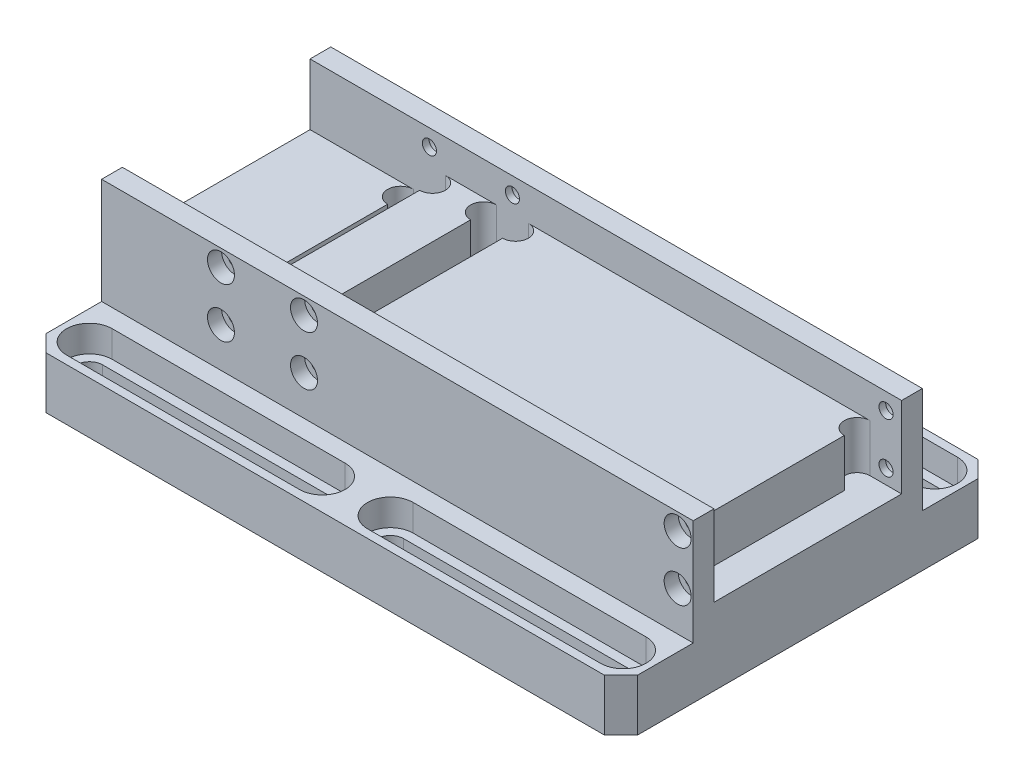
from build123d import *

# Parameters (mm, degrees)
SKETCH1_W                                      = 142.5
SKETCH1_H                                      = 90
BOSS_EXTRUDE1_DEPTH                            = 12.5
CHAMFER1_SIZE                                  = 4
SKETCH3_W                                      = 142.5
SKETCH3_H                                      = 55.2
BOSS_EXTRUDE2_DEPTH                            = 25.5
SKETCH7_W                                      = 142.5
SKETCH7_H                                      = 45.2
CUT_EXTRUDE4_DEPTH                             = 8
SKETCH8_W                                      = 7.7
SKETCH8_H                                      = 32.8
SKETCH8_H_2                                    = 6.2
SKETCH8_H_3                                    = 45.2
CUT_EXTRUDE5_DEPTH                             = 11.5
SKETCH9_W                                      = 24.9
SKETCH9_H                                      = 45.2
CUT_EXTRUDE6_DEPTH                             = 6.75
CBORE_START                                    = 24.2
CBORE_FOR_M3_HEX_SOCKET_HEAD_CAP_SCR_2_R       = 3.25
CBORE_FOR_M3_HEX_SOCKET_HEAD_CAP_SCREW1_DEPTH  = 3.4
CBORE_START_2                                  = 22.6
CBORE_FOR_M3_HEX_SOCKET_HEAD_CAP_SCR_3_O_R     = 1.7
CBORE_FOR_M3_HEX_SOCKET_HEAD_CAP_SCR_3_DEPTH   = 1.6
CBORE_SLOT_FOR_M6_HEX_SOCKET_HEAD_CAP_SC_DEPTH = 12.5
CBORE_START_3                                  = 6.1
CBORE_SLOT_FOR_M6_HEX_SOCKET_HEAD_CA_3_DEPTH   = 6.4


# Read off the part's stored shape, not the designer's step: CBORE for M3 Hex Socket Head Cap Screw1, CBORE SLOT for M6 Hex Socket Head Cap Screw1
with BuildPart() as part:
    # Sketch1 → Boss-Extrude1 (new body)
    with BuildSketch(Plane(origin=(0, 0, 0), x_dir=(1, 0, 0), z_dir=(0, 1, 0))):
        Rectangle(SKETCH1_W, SKETCH1_H)
    extrude(amount=BOSS_EXTRUDE1_DEPTH)

    # Chamfer1
    chamfer1_edges = [part.edges().sort_by_distance(p)[0] for p in [
        (-71.25, 6.25, 45),
        (-71.25, 6.25, -45),
        (71.25, 6.25, -45),
        (71.25, 6.25, 45),
    ]]
    chamfer(chamfer1_edges, length=CHAMFER1_SIZE)

    # Sketch3 → Boss-Extrude2 (add)
    with BuildSketch(Plane(origin=(0, 12.5, 0), x_dir=(1, 0, 0), z_dir=(0, 1, 0))):
        Rectangle(SKETCH3_W, SKETCH3_H)
    extrude(amount=BOSS_EXTRUDE2_DEPTH)

    # Sketch7 → Cut-Extrude4 (cut)
    with BuildSketch(Plane(origin=(0, 38, 0), x_dir=(1, 0, 0), z_dir=(0, 1, 0))):
        Rectangle(SKETCH7_W, SKETCH7_H)
    extrude(amount=-CUT_EXTRUDE4_DEPTH, mode=Mode.SUBTRACT)

    # Sketch8 → Cut-Extrude5 (cut)
    with BuildSketch(Plane(origin=(0, 30, 0), x_dir=(1, 0, 0), z_dir=(0, 1, 0))):
        with BuildLine():
            ThreePointArc((-46.35, 22.6), (-49.45, 19.5), (-46.35, 16.4))
            Line((-46.35, 16.4), (-46.35, 22.6))
        make_face()
        with BuildLine():
            Line((-38.65, 22.6), (-38.65, 16.4))
            ThreePointArc((-38.65, 16.4), (-35.55, 19.5), (-38.65, 22.6))
        make_face()
        with Locations((-42.5, 0)):
            Rectangle(SKETCH8_W, SKETCH8_H)
        with Locations((-42.5, 19.5)):
            Rectangle(SKETCH8_W, SKETCH8_H_2)
        with BuildLine():
            ThreePointArc((-46.35, -16.4), (-49.45, -19.5), (-46.35, -22.6))
            Line((-46.35, -22.6), (-46.35, -16.4))
        make_face()
        with BuildLine():
            Line((-38.65, -16.4), (-38.65, -22.6))
            ThreePointArc((-38.65, -22.6), (-35.55, -19.5), (-38.65, -16.4))
        make_face()
        with Locations((-42.5, -19.5)):
            Rectangle(SKETCH8_W, SKETCH8_H_2)
        with Locations((-22.5, 0)):
            Rectangle(SKETCH8_W, SKETCH8_H_3)
        with BuildLine():
            Line((-26.35, 16.4), (-18.65, 16.4))
            ThreePointArc((-18.65, 16.4), (-15.55, 19.5), (-18.65, 22.6))
            Line((-18.65, 22.6), (-26.35, 22.6))
            ThreePointArc((-26.35, 22.6), (-29.45, 19.5), (-26.35, 16.4))
        make_face()
        with BuildLine():
            Line((-26.35, -22.6), (-18.65, -22.6))
            ThreePointArc((-18.65, -22.6), (-15.55, -19.5), (-18.65, -16.4))
            Line((-18.65, -16.4), (-26.35, -16.4))
            ThreePointArc((-26.35, -16.4), (-29.45, -19.5), (-26.35, -22.6))
        make_face()
        with Locations((67.5, 0)):
            Rectangle(SKETCH8_W, SKETCH8_H_3)
        with BuildLine():
            Line((63.65, 16.4), (71.35, 16.4))
            ThreePointArc((71.35, 16.4), (74.45, 19.5), (71.35, 22.6))
            Line((71.35, 22.6), (63.65, 22.6))
            ThreePointArc((63.65, 22.6), (60.55, 19.5), (63.65, 16.4))
        make_face()
        with BuildLine():
            Line((63.65, -22.6), (71.35, -22.6))
            ThreePointArc((71.35, -22.6), (74.45, -19.5), (71.35, -16.4))
            Line((71.35, -16.4), (63.65, -16.4))
            ThreePointArc((63.65, -16.4), (60.55, -19.5), (63.65, -22.6))
        make_face()
    extrude(amount=-CUT_EXTRUDE5_DEPTH, mode=Mode.SUBTRACT)

    # Sketch9 → Cut-Extrude6 (cut)
    with BuildSketch(Plane(origin=(0, 30, 0), x_dir=(1, 0, 0), z_dir=(0, 1, 0))):
        with Locations((-58.8, 0)):
            Rectangle(SKETCH9_W, SKETCH9_H)
    extrude(amount=-CUT_EXTRUDE6_DEPTH, mode=Mode.SUBTRACT)

    # CBORE for M3 Hex Socket Head Cap Scr 2 → CBORE for M3 Hex Socket Head Cap Screw1 (cut)
    with BuildSketch(Plane.XY.offset(CBORE_START)):
        with Locations((-42.5, 34)):
            Circle(CBORE_FOR_M3_HEX_SOCKET_HEAD_CAP_SCR_2_R)
        with Locations((-42.5, 22)):
            Circle(CBORE_FOR_M3_HEX_SOCKET_HEAD_CAP_SCR_2_R)
        with Locations((-22.5, 22)):
            Circle(CBORE_FOR_M3_HEX_SOCKET_HEAD_CAP_SCR_2_R)
        with Locations((-22.5, 34)):
            Circle(CBORE_FOR_M3_HEX_SOCKET_HEAD_CAP_SCR_2_R)
        with Locations((67.5, 22)):
            Circle(CBORE_FOR_M3_HEX_SOCKET_HEAD_CAP_SCR_2_R)
        with Locations((67.5, 34)):
            Circle(CBORE_FOR_M3_HEX_SOCKET_HEAD_CAP_SCR_2_R)
    cbore_for_m3_hex_socket_head_cap_screw1 = extrude(amount=CBORE_FOR_M3_HEX_SOCKET_HEAD_CAP_SCREW1_DEPTH, mode=Mode.SUBTRACT)

    # CBORE for M3 Hex Socket Head Cap Scr 3 o → CBORE for M3 Hex Socket Head Cap Scr 3 (cut)
    with BuildSketch(Plane.XY.offset(CBORE_START_2)):
        with Locations((-42.5, 34)):
            Circle(CBORE_FOR_M3_HEX_SOCKET_HEAD_CAP_SCR_3_O_R)
        with Locations((-42.5, 22)):
            Circle(CBORE_FOR_M3_HEX_SOCKET_HEAD_CAP_SCR_3_O_R)
        with Locations((-22.5, 22)):
            Circle(CBORE_FOR_M3_HEX_SOCKET_HEAD_CAP_SCR_3_O_R)
        with Locations((-22.5, 34)):
            Circle(CBORE_FOR_M3_HEX_SOCKET_HEAD_CAP_SCR_3_O_R)
        with Locations((67.5, 22)):
            Circle(CBORE_FOR_M3_HEX_SOCKET_HEAD_CAP_SCR_3_O_R)
        with Locations((67.5, 34)):
            Circle(CBORE_FOR_M3_HEX_SOCKET_HEAD_CAP_SCR_3_O_R)
    cbore_for_m3_hex_socket_head_cap_scr_3 = extrude(amount=CBORE_FOR_M3_HEX_SOCKET_HEAD_CAP_SCR_3_DEPTH, mode=Mode.SUBTRACT)

    # Mirror1: CBORE for M3 Hex Socket Head Cap Screw1, CBORE for M3 Hex Socket Head Cap Scr 3 across plane
    add(cbore_for_m3_hex_socket_head_cap_screw1.mirror(Plane.XY), mode=Mode.SUBTRACT)
    add(cbore_for_m3_hex_socket_head_cap_scr_3.mirror(Plane.XY), mode=Mode.SUBTRACT)

    # CBORE SLOT for M6 Hex Socket Head Ca 2 → CBORE SLOT for M6 Hex Socket Head Cap Screw1 (cut)
    with BuildSketch(Plane(origin=(0, 0, 0), x_dir=(1, 0, 0), z_dir=(0, 1, 0))):
        with BuildLine():
            Line((8.2, -40.7), (64.3, -40.7))
            ThreePointArc((64.3, -40.7), (67.5, -37.5), (64.3, -34.3))
            Line((64.3, -34.3), (8.2, -34.3))
            ThreePointArc((8.2, -34.3), (5, -37.5), (8.2, -40.7))
        make_face()
        with BuildLine():
            ThreePointArc((-8.2, -40.7), (-5, -37.5), (-8.2, -34.3))
            Line((-8.2, -34.3), (-64.3, -34.3))
            ThreePointArc((-64.3, -34.3), (-67.5, -37.5), (-64.3, -40.7))
            Line((-64.3, -40.7), (-8.2, -40.7))
        make_face()
        with BuildLine():
            Line((8.2, 34.3), (64.3, 34.3))
            ThreePointArc((64.3, 34.3), (67.5, 37.5), (64.3, 40.7))
            Line((64.3, 40.7), (8.2, 40.7))
            ThreePointArc((8.2, 40.7), (5, 37.5), (8.2, 34.3))
        make_face()
        with BuildLine():
            ThreePointArc((-8.2, 34.3), (-5, 37.5), (-8.2, 40.7))
            Line((-8.2, 40.7), (-64.3, 40.7))
            ThreePointArc((-64.3, 40.7), (-67.5, 37.5), (-64.3, 34.3))
            Line((-64.3, 34.3), (-8.2, 34.3))
        make_face()
    extrude(amount=CBORE_SLOT_FOR_M6_HEX_SOCKET_HEAD_CAP_SC_DEPTH, mode=Mode.SUBTRACT)

    # CBORE SLOT for M6 Hex Socket Head Ca 3 o → CBORE SLOT for M6 Hex Socket Head Ca 3 (cut)
    # profile 1 of 4: a face of its own
    with BuildSketch(Plane(origin=(0, 0, 0), x_dir=(1, 0, 0), z_dir=(0, 1, 0)).offset(CBORE_START_3)):
        with BuildLine():
            Line((8.2, -43), (64.3, -43))
            ThreePointArc((64.3, -43), (69.8, -37.5), (64.3, -32))
            Line((64.3, -32), (8.2, -32))
            ThreePointArc((8.2, -32), (2.7, -37.5), (8.2, -43))
        make_face()
        with BuildLine():
            ThreePointArc((64.3, -34.3), (67.5, -37.5), (64.3, -40.7))
            Line((64.3, -40.7), (8.2, -40.7))
            ThreePointArc((8.2, -40.7), (5, -37.5), (8.2, -34.3))
            Line((8.2, -34.3), (64.3, -34.3))
        make_face(mode=Mode.SUBTRACT)
    # profile 2 of 4: a face of its own
    with BuildSketch(Plane(origin=(0, 0, 0), x_dir=(1, 0, 0), z_dir=(0, 1, 0)).offset(CBORE_START_3)):
        with BuildLine():
            ThreePointArc((-8.2, -43), (-2.7, -37.5), (-8.2, -32))
            Line((-8.2, -32), (-64.3, -32))
            ThreePointArc((-64.3, -32), (-69.8, -37.5), (-64.3, -43))
            Line((-64.3, -43), (-8.2, -43))
        make_face()
        with BuildLine():
            Line((-64.3, -34.3), (-8.2, -34.3))
            ThreePointArc((-8.2, -34.3), (-5, -37.5), (-8.2, -40.7))
            Line((-8.2, -40.7), (-64.3, -40.7))
            ThreePointArc((-64.3, -40.7), (-67.5, -37.5), (-64.3, -34.3))
        make_face(mode=Mode.SUBTRACT)
    # profile 3 of 4: a face of its own
    with BuildSketch(Plane(origin=(0, 0, 0), x_dir=(1, 0, 0), z_dir=(0, 1, 0)).offset(CBORE_START_3)):
        with BuildLine():
            Line((8.2, 32), (64.3, 32))
            ThreePointArc((64.3, 32), (69.8, 37.5), (64.3, 43))
            Line((64.3, 43), (8.2, 43))
            ThreePointArc((8.2, 43), (2.7, 37.5), (8.2, 32))
        make_face()
        with BuildLine():
            ThreePointArc((64.3, 40.7), (67.5, 37.5), (64.3, 34.3))
            Line((64.3, 34.3), (8.2, 34.3))
            ThreePointArc((8.2, 34.3), (5, 37.5), (8.2, 40.7))
            Line((8.2, 40.7), (64.3, 40.7))
        make_face(mode=Mode.SUBTRACT)
    # profile 4 of 4: a face of its own
    with BuildSketch(Plane(origin=(0, 0, 0), x_dir=(1, 0, 0), z_dir=(0, 1, 0)).offset(CBORE_START_3)):
        with BuildLine():
            ThreePointArc((-8.2, 32), (-2.7, 37.5), (-8.2, 43))
            Line((-8.2, 43), (-64.3, 43))
            ThreePointArc((-64.3, 43), (-69.8, 37.5), (-64.3, 32))
            Line((-64.3, 32), (-8.2, 32))
        make_face()
        with BuildLine():
            Line((-64.3, 40.7), (-8.2, 40.7))
            ThreePointArc((-8.2, 40.7), (-5, 37.5), (-8.2, 34.3))
            Line((-8.2, 34.3), (-64.3, 34.3))
            ThreePointArc((-64.3, 34.3), (-67.5, 37.5), (-64.3, 40.7))
        make_face(mode=Mode.SUBTRACT)
    extrude(amount=CBORE_SLOT_FOR_M6_HEX_SOCKET_HEAD_CA_3_DEPTH, mode=Mode.SUBTRACT)


solid = part.part
